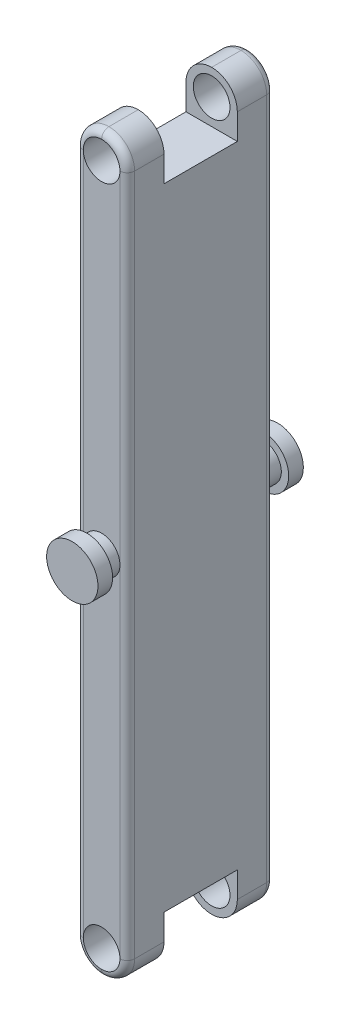
from build123d import *

# Parameters (mm, degrees)
SKETCH1_W           = 14
SKETCH1_H           = 20
BOSS_EXTRUDE1_DEPTH = 200
SKETCH2_W           = 14
SKETCH2_H           = 10
CUT_EXTRUDE1_DEPTH  = 14
SKETCH5_R           = 5
CUT_EXTRUDE4_DEPTH  = 10
SKETCH4_W           = 14
SKETCH4_H           = 10
CUT_EXTRUDE3_DEPTH  = 14
SKETCH6_R           = 5
CUT_EXTRUDE5_DEPTH  = 10
FILLET3_R           = 7
SKETCH7_R           = 5
BOSS_EXTRUDE2_DEPTH = 4
SKETCH8_R           = 7
BOSS_EXTRUDE3_DEPTH = 4
FILLET2_R           = 2


with BuildPart() as part:
    # Sketch1 → Boss-Extrude1 (new body)
    with BuildSketch(Plane(origin=(0, 0, 0), x_dir=(1, 0, 0), z_dir=(0, 1, 0))):
        with Locations((7, -10)):
            Rectangle(SKETCH1_W, SKETCH1_H)
    boss_extrude1 = extrude(amount=BOSS_EXTRUDE1_DEPTH)

    # Sketch2 → Cut-Extrude1 (cut)
    with BuildSketch(Plane.XZ):
        with Locations((7, 5)):
            Rectangle(SKETCH2_W, SKETCH2_H)
    cut_extrude1 = extrude(amount=-CUT_EXTRUDE1_DEPTH, mode=Mode.SUBTRACT)

    # Sketch5 → Cut-Extrude4 (cut)
    with BuildSketch(Plane(origin=(0, 0, 10), x_dir=(-1, 0, 0), z_dir=(0, 0, -1))):
        with Locations((-7, 7)):
            Circle(SKETCH5_R)
    cut_extrude4 = extrude(amount=-CUT_EXTRUDE4_DEPTH, mode=Mode.SUBTRACT)

    # Sketch4 → Cut-Extrude3 (cut)
    with BuildSketch(Plane(origin=(0, 200, 0), x_dir=(1, 0, 0), z_dir=(0, 1, 0))):
        with Locations((7, -5)):
            Rectangle(SKETCH4_W, SKETCH4_H)
    cut_extrude3 = extrude(amount=-CUT_EXTRUDE3_DEPTH, mode=Mode.SUBTRACT)

    # Sketch6 → Cut-Extrude5 (cut)
    with BuildSketch(Plane(origin=(0, 0, 10), x_dir=(-1, 0, 0), z_dir=(0, 0, -1))):
        with Locations((-7, 193)):
            Circle(SKETCH6_R)
    cut_extrude5 = extrude(amount=-CUT_EXTRUDE5_DEPTH, mode=Mode.SUBTRACT)

    # Mirror1: Boss-Extrude1, Cut-Extrude1, Cut-Extrude4, Cut-Extrude3, Cut-Extrude5 across plane
    add(boss_extrude1.mirror(Plane(origin=(0, 200, 0), x_dir=(1, 0, 0), z_dir=(0, 0, 1))))
    add(cut_extrude1.mirror(Plane(origin=(0, 200, 0), x_dir=(1, 0, 0), z_dir=(0, 0, 1))), mode=Mode.SUBTRACT)
    add(cut_extrude4.mirror(Plane(origin=(0, 200, 0), x_dir=(1, 0, 0), z_dir=(0, 0, 1))), mode=Mode.SUBTRACT)
    add(cut_extrude3.mirror(Plane(origin=(0, 200, 0), x_dir=(1, 0, 0), z_dir=(0, 0, 1))), mode=Mode.SUBTRACT)
    add(cut_extrude5.mirror(Plane(origin=(0, 200, 0), x_dir=(1, 0, 0), z_dir=(0, 0, 1))), mode=Mode.SUBTRACT)

    # Fillet3
    fillet3_edges = [part.edges().sort_by_distance(p)[0] for p in [
        (0, 200, 15),
        (14, 200, 15),
        (0, 200, -15),
        (14, 200, -15),
        (0, 0, -15),
        (14, 0, -15),
        (0, 0, 15),
        (14, 0, 15),
    ]]
    fillet(fillet3_edges, radius=FILLET3_R - 0.0001)  # a hair under: the kernel refuses the full size

    # Sketch7 → Boss-Extrude2 (add)
    with BuildSketch(Plane.XY.offset(20)):
        with Locations(Location((7, 100, 0), (0, 0, 180))):
            Circle(SKETCH7_R)
    boss_extrude2 = extrude(amount=BOSS_EXTRUDE2_DEPTH)

    # Sketch8 → Boss-Extrude3 (add)
    with BuildSketch(Plane.XY.offset(24)):
        with Locations((7, 100)):
            Circle(SKETCH8_R)
    boss_extrude3 = extrude(amount=BOSS_EXTRUDE3_DEPTH)

    # Mirror2: Boss-Extrude2, Boss-Extrude3 across plane
    add(boss_extrude2.mirror(Plane.XY))
    add(boss_extrude3.mirror(Plane.XY))

    # Fillet2
    fillet2_edges = [part.edges().sort_by_distance(p)[0] for p in [
        (14, 100, 20),
        (0, 100, 20),
        (0, 100, -20),
        (14, 100, -20),
        (11.949776758, 2.050223242, 20),
        (11.949776758, 197.949776758, 20),
        (11.949776758, 2.050223242, -20),
        (11.949776758, 197.949776758, -20),
        (2.050223242, 197.949776758, -20),
    ]]
    fillet(fillet2_edges, radius=FILLET2_R - 0.0001)  # a hair under: the kernel refuses the full size


solid = part.part
